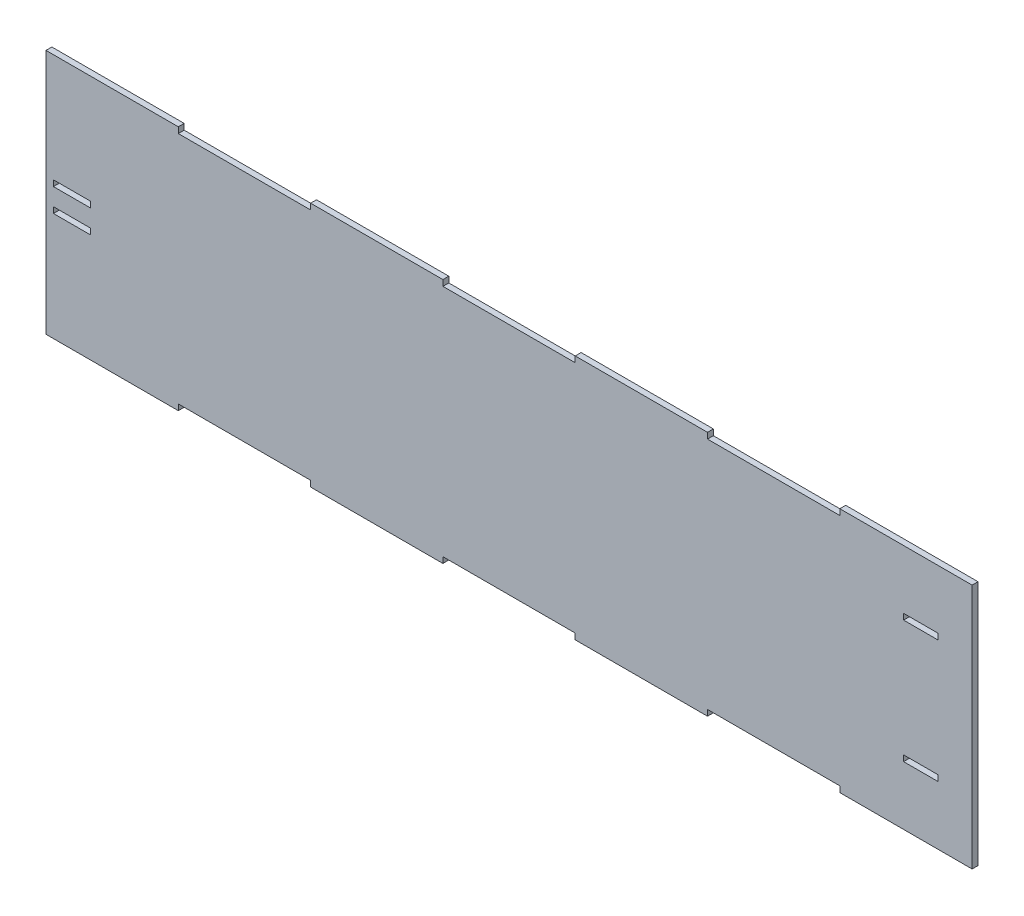
from build123d import *

# Parameters (mm, degrees)
SKETCH1_W           = 20
SKETCH1_H           = 3.175
SKETCH1_W_2         = 18.5
BOSS_EXTRUDE1_DEPTH = 3.175


with BuildPart() as part:
    # Sketch1 → Boss-Extrude1 (new body)
    with BuildSketch(Plane.XY):
        Polygon((0, 132.75), (71.428571429, 132.75), (71.428571429, 129.575), (142.857142857, 129.575), (142.857142857, 132.75), (214.285714286, 132.75), (214.285714286, 129.575), (285.714285714, 129.575), (285.714285714, 132.75), (357.142857143, 132.75), (357.142857143, 129.575), (428.571428571, 129.575), (428.571428571, 132.75), (500, 132.75), (500, 0), (428.571428571, 0), (428.571428571, 3.175), (357.142857143, 3.175), (357.142857143, 0), (285.714285714, 0), (285.714285714, 3.175), (214.285714286, 3.175), (214.285714286, 0), (142.857142857, 0), (142.857142857, 3.175), (71.428571429, 3.175), (71.428571429, 0), (0, 0), align=None)
        with Locations((14, 60.0875)):
            Rectangle(SKETCH1_W, SKETCH1_H, mode=Mode.SUBTRACT)
        with Locations((14, 72.6625)):
            Rectangle(SKETCH1_W, SKETCH1_H, mode=Mode.SUBTRACT)
        with Locations((472.25, 33.2875)):
            Rectangle(SKETCH1_W_2, SKETCH1_H, mode=Mode.SUBTRACT)
        with Locations((472.25, 99.4625)):
            Rectangle(SKETCH1_W_2, SKETCH1_H, mode=Mode.SUBTRACT)
    extrude(amount=BOSS_EXTRUDE1_DEPTH)


solid = part.part
